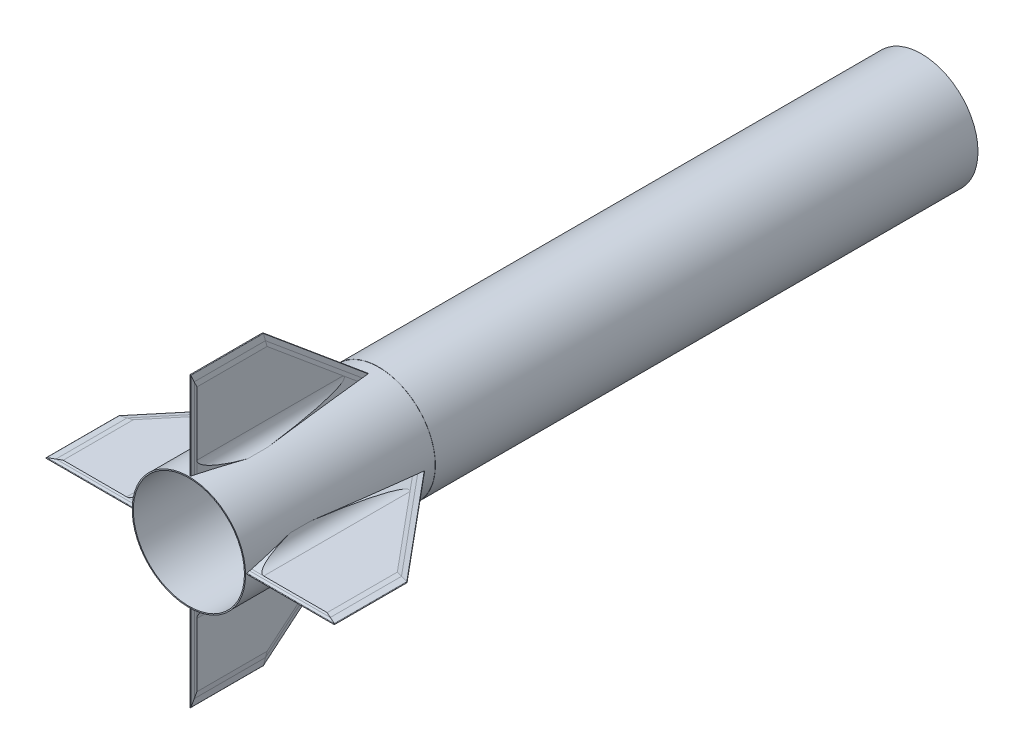
from build123d import *

# Parameters (mm, degrees)
FINBODY_DEPTH            = 3.175
CARBONFIBERX5_DEPTH      = 0.762
CUT_EXTRUDE1_START       = 24.777267503
CUT_EXTRUDE1_OUTLINE_W   = 131
CUT_EXTRUDE1_OUTLINE_H   = 177
CUT_EXTRUDE1_DEPTH       = 3.222732497
CUT_EXTRUDE1_START_2     = 27.910323391
CUT_EXTRUDE1_2_OUTLINE_W = 131
CUT_EXTRUDE1_2_OUTLINE_H = 177
CUT_EXTRUDE1_2_DEPTH     = 3.089676609
CUT_EXTRUDE1_START_3     = -196
CUT_EXTRUDE1_3_DEPTH     = 277.303418757
CUT_EXTRUDE4_DEPTH       = 280.153404373
CUT_EXTRUDE4_DEPTH_BACK  = 280.153404373
CUT_EXTRUDE5_DEPTH       = 277.720944264
CUT_EXTRUDE5_DEPTH_BACK  = 277.720944264
SKETCH13_R               = 78.36
SKETCH13_R_2             = 77.09
BOSS_EXTRUDE1_DEPTH      = 914.4
BOSS_EXTRUDE2_REACH      = 933.171
BOSS_EXTRUDE3_START      = -12.512054024
BOSS_EXTRUDE3_DEPTH      = 28.26665103
BOSS_EXTRUDE3_START_2    = -231.688277832
BOSS_EXTRUDE3_2_DEPTH    = 222.91982446
BOSS_EXTRUDE3_START_3    = -78
BOSS_EXTRUDE3_3_DEPTH    = 92
CIRPATTERN1_COUNT        = 4
SKETCH18_W               = 519.548726742
SKETCH18_H               = 439.659397243
CUT_EXTRUDE6_DEPTH       = 651
SKETCH17_R               = 78.614
SKETCH17_R_2             = 78.36
SKETCH17_R_3             = 77.09
BOSS_EXTRUDE4_DEPTH      = 0.1
SKETCH19_R               = 78.614
SKETCH19_R_2             = 77.09
BOSS_EXTRUDE5_DEPTH      = 0.1
SKETCH20_R               = 78.36
SKETCH20_R_2             = 77.09
BOSS_EXTRUDE6_DEPTH      = 914.4
SKETCH21_W               = 490.676006992
SKETCH21_H               = 455.150743556
CUT_EXTRUDE7_DEPTH       = 263.4
SKETCH22_R               = 78.36
SKETCH22_R_2             = 77.09
BOSS_EXTRUDE7_DEPTH      = 101.6


with BuildPart() as part:
    # Sketch1 → FinBody (new body)
    with BuildSketch(Plane(origin=(0, 0, 0), x_dir=(1, 0, 0), z_dir=(0, 1, 0))):
        Polygon((0, 0), (0, 254), (127, 101.6), (127, 0), align=None)
    extrude(amount=FINBODY_DEPTH)

    # Cut-Extrude1 3 outline → Cut-Extrude1 3 (cut)
    with BuildSketch(Plane(origin=(0, 0, 0), x_dir=(0.7682212795973759, 0, -0.6401843996644799), z_dir=(0.6401843996644799, 0, 0.7682212795973759)).offset(CUT_EXTRUDE1_START_3)):
        with BuildLine():
            Line((152.937458047, 3.175), (158.760273677, 2.219021404))
            add(Edge.make_bspline(
                [(158.760273677, 2.219021404), (159.124298163, 2.159256568), (159.124298163, 1.5875), (159.124298163, 1.015743432), (158.760273677, 0.955978596)],
                knots=[1.675516082, 1.675516082, 1.675516082, 3.141592654, 3.141592654, 4.607669225, 4.607669225, 4.607669225], degree=2, weights=[1, 0.743144825, 1, 0.743144825, 1]))
            Line((158.760273677, 0.955978596), (152.937458047, 0))
            Line((152.937458047, 0), (162.606837515, 0))
            Line((162.606837515, 0), (162.606837515, 3.175))
            Line((162.606837515, 3.175), (152.937458047, 3.175))
        make_face()
    extrude(amount=CUT_EXTRUDE1_3_DEPTH, mode=Mode.SUBTRACT)


with BuildPart() as body_2:
    # Sketch2 → CarbonFiberx5 (new body)
    with BuildSketch(Plane(origin=(0, 3.175, 0), x_dir=(1, 0, 0), z_dir=(0, 1, 0))):
        Polygon((0, 0), (127, 0), (127, 101.6), (0, 254), align=None)
    extrude(amount=CARBONFIBERX5_DEPTH)


with BuildPart() as body_3:
    # Mirror2: mirrored copy
    add(body_2.part.mirror(Plane.ZX.offset(1.5875)))

    # Cut-Extrude1: read off the stored shape, not the designer's step
    # Cut-Extrude1 outline → Cut-Extrude1 (cut)
    with BuildSketch(Plane(origin=(0, 0, 0), x_dir=(0.9922247669521616, 0.12377707738096075, 0.013009495061545442), z_dir=(0.12445887612672998, -0.9867892558606077, -0.10371573010560797)).offset(CUT_EXTRUDE1_START)):
        with Locations((60.5, -165.5)):
            Rectangle(CUT_EXTRUDE1_OUTLINE_W, CUT_EXTRUDE1_OUTLINE_H)
    extrude(amount=CUT_EXTRUDE1_DEPTH, mode=Mode.SUBTRACT)


with BuildPart() as body_2_1:
    add(body_2.part)

    # Cut-Extrude1 2 outline → Cut-Extrude1 2 (cut)
    with BuildSketch(Plane(origin=(0, 0, 0), x_dir=(0.9922247669521616, -0.12377707738096075, 0.013009495061545442), z_dir=(0.12445887612672998, 0.9867892558606077, -0.10371573010560797)).offset(CUT_EXTRUDE1_START_2)):
        with Locations((60.5, 165.5)):
            Rectangle(CUT_EXTRUDE1_2_OUTLINE_W, CUT_EXTRUDE1_2_OUTLINE_H)
    extrude(amount=CUT_EXTRUDE1_2_DEPTH, mode=Mode.SUBTRACT)


with BuildPart() as cut_extrude4_tool:
    # Sketch11 → Cut-Extrude4 (new, two sides: drawn at the far end of the back side and taken through both)
    with BuildSketch(Plane.XY.offset(-CUT_EXTRUDE4_DEPTH_BACK)):
        with BuildLine():
            Line((111.895946429, 3.175), (120.991475206, 2.219021404))
            ThreePointArc((120.991475206, 2.219021404), (121.560099632, 1.5875), (120.991475206, 0.955978596))
            Line((120.991475206, 0.955978596), (111.895946429, 0))
            Line((111.895946429, 0), (127, 0))
            Line((127, 0), (127, 3.175))
            Line((127, 3.175), (111.895946429, 3.175))
        make_face()
        Polygon((104.646000715, 3.937), (111.895946429, 3.175), (127, 3.175), (127, 3.937), align=None)
        Polygon((127, 0), (111.895946429, 0), (104.646000715, -0.762), (127, -0.762), align=None)
    extrude(amount=CUT_EXTRUDE4_DEPTH + CUT_EXTRUDE4_DEPTH_BACK)


with BuildPart() as part_1:
    add(part.part)

    # Cut-Extrude4: cut by cut_extrude4_tool
    add(cut_extrude4_tool.part, mode=Mode.SUBTRACT)


with BuildPart() as body_2_2:
    add(body_2_1.part)

    # Cut-Extrude4: cut by cut_extrude4_tool
    add(cut_extrude4_tool.part, mode=Mode.SUBTRACT)


with BuildPart() as body_3_1:
    add(body_3.part)

    # Cut-Extrude4: cut by cut_extrude4_tool
    add(cut_extrude4_tool.part, mode=Mode.SUBTRACT)


with BuildPart() as cut_extrude5_tool:
    # Sketch12 → Cut-Extrude5 (new, two sides: drawn at the far end of the back side and taken through both)
    with BuildSketch(Plane.ZY.offset(-CUT_EXTRUDE5_DEPTH_BACK)):
        with BuildLine():
            Line((-5.924630657, 3.175), (-2.289101505, 2.2008629))
            ThreePointArc((-2.289101505, 2.2008629), (-1.818451599, 1.5875), (-2.289101505, 0.9741371))
            Line((-2.289101505, 0.9741371), (-5.924630657, 0))
            Line((-5.924630657, 0), (0, 0))
            Line((0, 0), (0, 3.175))
            Line((0, 3.175), (-5.924630657, 3.175))
        make_face()
        Polygon((-8.768453372, 3.937), (-5.924630657, 3.175), (0, 3.175), (0, 3.937), align=None)
        Polygon((0, 0), (-5.924630657, 0), (-8.768453372, -0.762), (0, -0.762), align=None)
    extrude(amount=CUT_EXTRUDE5_DEPTH + CUT_EXTRUDE5_DEPTH_BACK)


with BuildPart() as part_2:
    add(part_1.part)

    # Cut-Extrude5: cut by cut_extrude5_tool
    add(cut_extrude5_tool.part, mode=Mode.SUBTRACT)



with BuildPart() as body_2_3:
    add(body_2_2.part)

    # Cut-Extrude5: cut by cut_extrude5_tool
    add(cut_extrude5_tool.part, mode=Mode.SUBTRACT)


with BuildPart() as body_3_2:
    add(body_3_1.part)

    # Cut-Extrude5: cut by cut_extrude5_tool
    add(cut_extrude5_tool.part, mode=Mode.SUBTRACT)


with BuildPart() as body_4:
    # Sketch13 → Boss-Extrude1 (new body)
    with BuildSketch(Plane.XY):
        with Locations((-78.36, 1.5875)):
            Circle(SKETCH13_R)
        with Locations((-78.36, 1.5875)):
            Circle(SKETCH13_R_2, mode=Mode.SUBTRACT)
    extrude(amount=-BOSS_EXTRUDE1_DEPTH)


with BuildPart() as part_3:
    add(part_2.part)

    # Boss-Extrude2: up to this face of the body
    boss_extrude2_end = body_4.part.faces().sort_by_distance((-156.72, 1.5875, -457.2))[0]
    # Sketch14 → Boss-Extrude2 (add, up to the picked face)
    with BuildSketch(Plane.ZY, mode=Mode.PRIVATE) as boss_extrude2_sk1:
        with BuildLine():
            ThreePointArc((-2.289101505, 0.9741371), (-1.818451599, 1.5875), (-2.289101505, 2.2008629))
            Line((-2.289101505, 2.2008629), (-5.924630657, 3.175))
            Line((-5.924630657, 3.175), (-238.895946429, 3.175))
            Line((-238.895946429, 3.175), (-247.991475206, 2.219021404))
            ThreePointArc((-247.991475206, 2.219021404), (-248.560099632, 1.5875), (-247.991475206, 0.955978596))
            Line((-247.991475206, 0.955978596), (-238.895946429, 0))
            Line((-238.895946429, 0), (-5.924630657, 0))
            Line((-5.924630657, 0), (-2.289101505, 0.9741371))
        make_face()
    boss_extrude2_tool1 = split(extrude(boss_extrude2_sk1.sketch, amount=BOSS_EXTRUDE2_REACH, mode=Mode.PRIVATE), bisect_by=boss_extrude2_end, keep=Keep.BOTH, mode=Mode.PRIVATE)
    # Sketch14 → Boss-Extrude2 (add, up to the picked face)
    with BuildSketch(Plane.ZY, mode=Mode.PRIVATE) as boss_extrude2_sk2:
        Polygon((-238.895946429, 3.175), (-5.924630657, 3.175), (-8.768453372, 3.937), (-231.646000715, 3.937), align=None)
    boss_extrude2_tool2 = split(extrude(boss_extrude2_sk2.sketch, amount=BOSS_EXTRUDE2_REACH, mode=Mode.PRIVATE), bisect_by=boss_extrude2_end, keep=Keep.BOTH, mode=Mode.PRIVATE)
    # Sketch14 → Boss-Extrude2 (add, up to the picked face)
    with BuildSketch(Plane.ZY, mode=Mode.PRIVATE) as boss_extrude2_sk3:
        Polygon((-8.768453372, -0.762), (-5.924630657, 0), (-238.895946429, 0), (-231.646000715, -0.762), align=None)
    boss_extrude2_tool3 = split(extrude(boss_extrude2_sk3.sketch, amount=BOSS_EXTRUDE2_REACH, mode=Mode.PRIVATE), bisect_by=boss_extrude2_end, keep=Keep.BOTH, mode=Mode.PRIVATE)
    add(boss_extrude2_tool1.solids().sort_by(Axis((0, 1.5875, -124.365106), (-1, 0, 0)))[0])
    add(boss_extrude2_tool1.solids().sort_by(Axis((0, 1.5875, -124.365106), (-1, 0, 0)))[1])
    add(boss_extrude2_tool2.solids().sort_by(Axis((0, 3.553188, -121.316888), (-1, 0, 0)))[0])
    add(boss_extrude2_tool3.solids().sort_by(Axis((0, -0.378188, -121.316888), (-1, 0, 0)))[0])


with BuildPart() as body_5:
    # Boss-Extrude3: read off the stored shape, not the designer's step
    # Boss-Extrude3 outline → Boss-Extrude3 (new body)
    with BuildSketch(Plane.XY.offset(-80).offset(BOSS_EXTRUDE3_START)):
        with BuildLine():
            Line((-0.035230931, 3.937), (16.670360937, 3.937))
            ThreePointArc((16.670360937, 3.937), (4.771236529, 8.110396277), (-1.914264624, 18.80200385))
            ThreePointArc((-1.914264624, 18.80200385), (-0.618638123, 11.414516514), (-0.035230931, 3.937))
        make_face()
    extrude(amount=BOSS_EXTRUDE3_DEPTH)

    # Boss-Extrude3 2 outline → Boss-Extrude3 2 (add)
    with BuildSketch(Plane.XY.offset(BOSS_EXTRUDE3_START_2)):
        with BuildLine():
            Line((-0.035230931, 3.937), (16.670360937, 3.937))
            ThreePointArc((16.670360937, 3.937), (4.771236529, 8.110396277), (-1.914264624, 18.80200385))
            ThreePointArc((-1.914264624, 18.80200385), (-0.618638123, 11.414516514), (-0.035230931, 3.937))
        make_face()
    extrude(amount=BOSS_EXTRUDE3_2_DEPTH)

    # Boss-Extrude3 3 outline → Boss-Extrude3 3 (cut)
    with BuildSketch(Plane(origin=(0, 0, 0), x_dir=(0.08100015681862362, 0.9963378062365744, 0.02738522337043979), z_dir=(0.9438539434124279, -0.08550424471153754, 0.31910618552625897)).offset(BOSS_EXTRUDE3_START_3)):
        Polygon((3.679602178, -8.295275792), (16.818716822, -60.248063362), (18.726719461, -67.792411551), (20, -58.66170214), (20, -6), (3.099115679, -6), align=None)
        Polygon((20, -72.827033378), (18.726719461, -67.792411551), (16.04462827, -87.025718364), (-2.425107008, -219.47240273), (-3.335382672, -226), (20, -226), align=None)
    extrude(amount=BOSS_EXTRUDE3_3_DEPTH, mode=Mode.SUBTRACT)


with BuildPart() as body_6:
    # Mirror3: mirrored copy
    add(body_5.part.mirror(Plane.ZX.offset(1.5875)))


with BuildPart() as cirpattern1_1:
    # CirPattern1: pattern copy
    add(body_6.part.rotate(Axis((-78.36, 1.5875, -914.4), (0, 0, 1)), 1 * 360 / CIRPATTERN1_COUNT))


with BuildPart() as cirpattern1_2:
    # CirPattern1: pattern copy
    add(body_6.part.rotate(Axis((-78.36, 1.5875, -914.4), (0, 0, 1)), 2 * 360 / CIRPATTERN1_COUNT))


with BuildPart() as cirpattern1_3:
    # CirPattern1: pattern copy
    add(body_6.part.rotate(Axis((-78.36, 1.5875, -914.4), (0, 0, 1)), 3 * 360 / CIRPATTERN1_COUNT))


with BuildPart() as cirpattern1_4:
    # CirPattern1: pattern copy
    add(body_3_2.part.rotate(Axis((-78.36, 1.5875, -914.4), (0, 0, 1)), 1 * 360 / CIRPATTERN1_COUNT))


with BuildPart() as cirpattern1_5:
    # CirPattern1: pattern copy
    add(body_3_2.part.rotate(Axis((-78.36, 1.5875, -914.4), (0, 0, 1)), 2 * 360 / CIRPATTERN1_COUNT))


with BuildPart() as cirpattern1_6:
    # CirPattern1: pattern copy
    add(body_3_2.part.rotate(Axis((-78.36, 1.5875, -914.4), (0, 0, 1)), 3 * 360 / CIRPATTERN1_COUNT))


with BuildPart() as cirpattern1_7:
    # CirPattern1: pattern copy
    add(part_3.part.rotate(Axis((-78.36, 1.5875, -914.4), (0, 0, 1)), 1 * 360 / CIRPATTERN1_COUNT))


with BuildPart() as cirpattern1_8:
    # CirPattern1: pattern copy
    add(part_3.part.rotate(Axis((-78.36, 1.5875, -914.4), (0, 0, 1)), 2 * 360 / CIRPATTERN1_COUNT))


with BuildPart() as cirpattern1_9:
    # CirPattern1: pattern copy
    add(part_3.part.rotate(Axis((-78.36, 1.5875, -914.4), (0, 0, 1)), 3 * 360 / CIRPATTERN1_COUNT))


with BuildPart() as cirpattern1_10:
    # CirPattern1: pattern copy
    add(body_2_3.part.rotate(Axis((-78.36, 1.5875, -914.4), (0, 0, 1)), 1 * 360 / CIRPATTERN1_COUNT))


with BuildPart() as cirpattern1_11:
    # CirPattern1: pattern copy
    add(body_2_3.part.rotate(Axis((-78.36, 1.5875, -914.4), (0, 0, 1)), 2 * 360 / CIRPATTERN1_COUNT))


with BuildPart() as cirpattern1_12:
    # CirPattern1: pattern copy
    add(body_2_3.part.rotate(Axis((-78.36, 1.5875, -914.4), (0, 0, 1)), 3 * 360 / CIRPATTERN1_COUNT))


with BuildPart() as cirpattern1_13:
    # CirPattern1: pattern copy
    add(body_5.part.rotate(Axis((-78.36, 1.5875, -914.4), (0, 0, 1)), 1 * 360 / CIRPATTERN1_COUNT))


with BuildPart() as cirpattern1_14:
    # CirPattern1: pattern copy
    add(body_5.part.rotate(Axis((-78.36, 1.5875, -914.4), (0, 0, 1)), 2 * 360 / CIRPATTERN1_COUNT))


with BuildPart() as cirpattern1_15:
    # CirPattern1: pattern copy
    add(body_5.part.rotate(Axis((-78.36, 1.5875, -914.4), (0, 0, 1)), 3 * 360 / CIRPATTERN1_COUNT))


with BuildPart() as body_4_1:
    add(body_4.part)

    # Sketch18 → Cut-Extrude6 (cut)
    with BuildSketch(Plane(origin=(0, 0, -914.4), x_dir=(-1, 0, 0), z_dir=(0, 0, -1))):
        with Locations((83.18552997, 2.793882493)):
            Rectangle(SKETCH18_W, SKETCH18_H)
    extrude(amount=-CUT_EXTRUDE6_DEPTH, mode=Mode.SUBTRACT)

    # Sketch17 → Boss-Extrude4 (add)
    # profile 1 of 2: a face of its own
    with BuildSketch(Plane.XY):
        with Locations((-78.36, 1.5875)):
            Circle(SKETCH17_R)
        with Locations((-78.36, 1.5875)):
            Circle(SKETCH17_R_2, mode=Mode.SUBTRACT)
    # profile 2 of 2: a face of its own
    with BuildSketch(Plane.XY):
        with Locations((-78.36, 1.5875)):
            Circle(SKETCH17_R_2)
        with Locations((-78.36, 1.5875)):
            Circle(SKETCH17_R_3, mode=Mode.SUBTRACT)
    extrude(amount=-BOSS_EXTRUDE4_DEPTH)

    # Sketch19 → Boss-Extrude5 (add)
    with BuildSketch(Plane(origin=(0, 0, -263.4), x_dir=(-1, 0, 0), z_dir=(0, 0, -1))):
        with Locations(Location((78.36, 1.5875, 0), (0, 0, 180))):
            Circle(SKETCH19_R)
        with Locations(Location((78.36, 1.5875, 0), (0, 0, 180))):
            Circle(SKETCH19_R_2, mode=Mode.SUBTRACT)
    extrude(amount=-BOSS_EXTRUDE5_DEPTH)

    # Sketch20 → Boss-Extrude6 (add)
    with BuildSketch(Plane(origin=(0, 0, -263.4), x_dir=(-1, 0, 0), z_dir=(0, 0, -1))):
        with Locations(Location((78.36, 1.5875, 0), (0, 0, 180))):
            Circle(SKETCH20_R)
        with Locations(Location((78.36, 1.5875, 0), (0, 0, 180))):
            Circle(SKETCH20_R_2, mode=Mode.SUBTRACT)
    extrude(amount=BOSS_EXTRUDE6_DEPTH)

    # Sketch21 → Cut-Extrude7 (cut)
    with BuildSketch(Plane(origin=(0, 0, -1177.8), x_dir=(-1, 0, 0), z_dir=(0, 0, -1))):
        with Locations((78.493553622, -8.429021645)):
            Rectangle(SKETCH21_W, SKETCH21_H)
    extrude(amount=-CUT_EXTRUDE7_DEPTH, mode=Mode.SUBTRACT)

    # Sketch22 → Boss-Extrude7 (add)
    with BuildSketch(Plane(origin=(0, 0, -914.4), x_dir=(-1, 0, 0), z_dir=(0, 0, -1))):
        with Locations(Location((78.36, 1.5875, 0), (0, 0, 180))):
            Circle(SKETCH22_R)
        with Locations(Location((78.36, 1.5875, 0), (0, 0, 180))):
            Circle(SKETCH22_R_2, mode=Mode.SUBTRACT)
    extrude(amount=BOSS_EXTRUDE7_DEPTH)


solid = Compound([body_2_3.part, body_3_2.part, part_3.part, body_5.part, body_6.part, cirpattern1_1.part, cirpattern1_2.part, cirpattern1_3.part, cirpattern1_4.part, cirpattern1_5.part, cirpattern1_6.part, cirpattern1_7.part, cirpattern1_8.part, cirpattern1_9.part, cirpattern1_10.part, cirpattern1_11.part, cirpattern1_12.part, cirpattern1_13.part, cirpattern1_14.part, cirpattern1_15.part, body_4_1.part])
